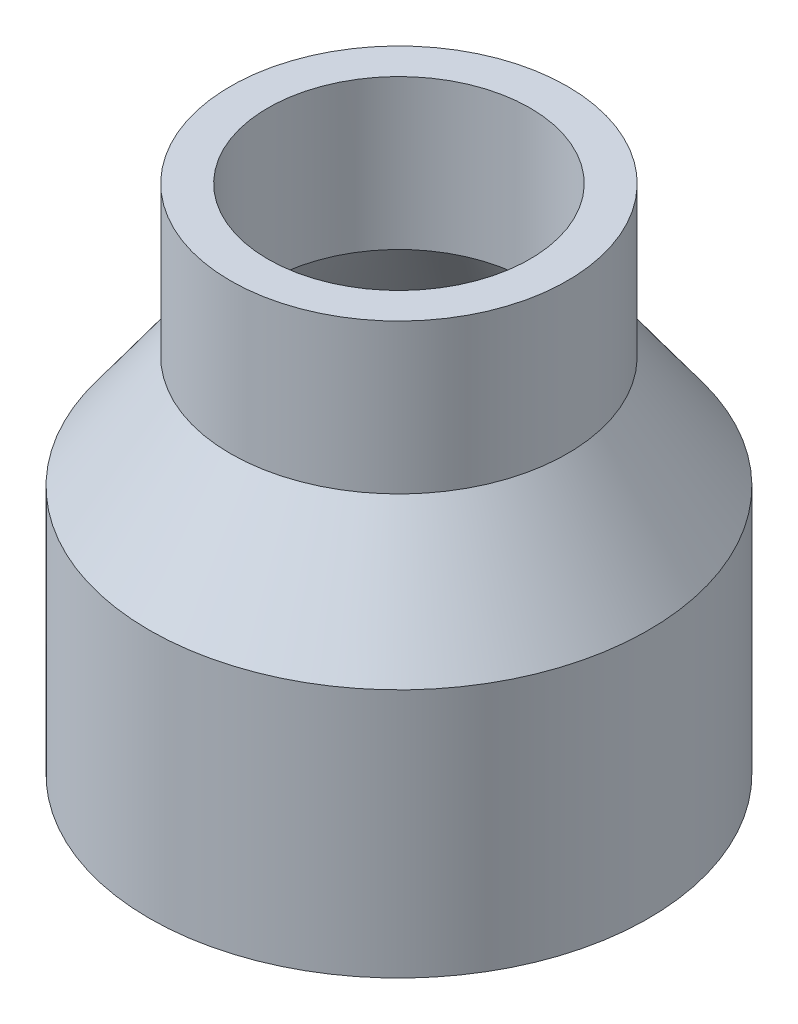
from build123d import *

# Parameters (mm, degrees)
SKETCH1_R           = 10
SKETCH1_R_2         = 8
BOSS_EXTRUDE1_DEPTH = 10
SKETCH2_R           = 6.75
SKETCH2_R_2         = 5.25
BOSS_EXTRUDE2_DEPTH = 6
THREAD1_PITCH       = 1


with BuildPart() as part:
    # Sketch1 → Boss-Extrude1 (new body)
    with BuildSketch(Plane(origin=(0, 0, 0), x_dir=(1, 0, 0), z_dir=(0, 1, 0))):
        with Locations(Location((0, 0, 0), (0, 0, 270))):
            Circle(SKETCH1_R)
        with Locations(Location((0, 0, 0), (0, 0, 270))):
            Circle(SKETCH1_R_2, mode=Mode.SUBTRACT)
    extrude(amount=BOSS_EXTRUDE1_DEPTH)



with BuildPart() as body_2:
    # Sketch2 → Boss-Extrude2 (new body)
    with BuildSketch(Plane(origin=(0, 14.5, 0), x_dir=(1, 0, 0), z_dir=(0, 1, 0))):
        with Locations(Location((0, 0, 0), (0, 0, 270))):
            Circle(SKETCH2_R)
        with Locations(Location((0, 0, 0), (0, 0, 270))):
            Circle(SKETCH2_R_2, mode=Mode.SUBTRACT)
    extrude(amount=BOSS_EXTRUDE2_DEPTH)


with BuildPart() as part_1:
    add(part.part)

    add(body_2.part)  # Revolve2 merges body 2
    # Sketch5 → Revolve2 (revolve)
    with BuildSketch(Plane.XY, mode=Mode.PRIVATE) as revolve2_sk:
        Polygon((-8, 10), (-5.25, 14.5), (-6.75, 14.5), (-10, 10), align=None)
    revolve(revolve2_sk.sketch.rotate(Axis((0, 10.152145178, 0), (0, 1, 0)), 270), axis=Axis((0, 10.152145178, 0), (0, 1, 0)))

    # Thread1: the profile of Thread Profile1 profile screwed along a right-hand helix of 10 turns, 8 arcs to a turn; built about Z, then put on its axis
    thread1_z = Axis((0, 0, 0), (0, 0, 1))
    thread1_corners = [(8.0003, 0, -0.000173205), (8.0003, 0, 0.875173202), (7.458734125, 0, 0.562499999), (7.458734125, 0, 0.312499999)]
    with BuildLine(mode=Mode.PRIVATE) as thread1_profile:
        Line(thread1_corners[0], thread1_corners[1])
        Line(thread1_corners[1], thread1_corners[2])
        Line(thread1_corners[2], thread1_corners[3])
        Line(thread1_corners[3], thread1_corners[0])
    thread1_cap = Face(thread1_profile.wire())
    thread1_turn_angles = [0, 22.5, 45, 67.5, 90, 112.5, 135, 157.5, 180, 202.5, 225, 247.5, 270, 292.5, 315, 337.5, 360]
    thread1_turn_weights = [1, 0.9238795325112867, 1, 0.9238795325112867, 1, 0.9238795325112867, 1, 0.9238795325112867, 1, 0.9238795325112867, 1, 0.9238795325112867, 1, 0.9238795325112867, 1, 0.9238795325112867, 1]
    thread1_turn_rails = [Edge.make_bspline([Vector(p[0], p[1], 0).rotate(thread1_z, thread1_turn_angles[k]) / thread1_turn_weights[k] + Vector(0, 0, p[2] + THREAD1_PITCH * thread1_turn_angles[k] / 360) for k in range(17)], [0, 0, 0, 1, 1, 2, 2, 3, 3, 4, 4, 5, 5, 6, 6, 7, 7, 8, 8, 8], 2, thread1_turn_weights) for p in thread1_corners]
    thread1_turn_sides = [Face.make_surface_from_curves(thread1_turn_rails[p[0]], thread1_turn_rails[p[1]]) for p in [(0, 1), (1, 2), (2, 3), (3, 0)]]
    thread1 = Plane(origin=(0, 0, 0), x_dir=(1, 0, 0), z_dir=(0, 1, 0)) * Solid(Shell([*[p.moved(Location((0, 0, THREAD1_PITCH * i))) for i in range(10) for p in thread1_turn_sides], thread1_cap, thread1_cap.rotate(thread1_z, 3600).moved(Location((0, 0, THREAD1_PITCH * 3600 / 360)))]))
    add(thread1)


solid = part_1.part
